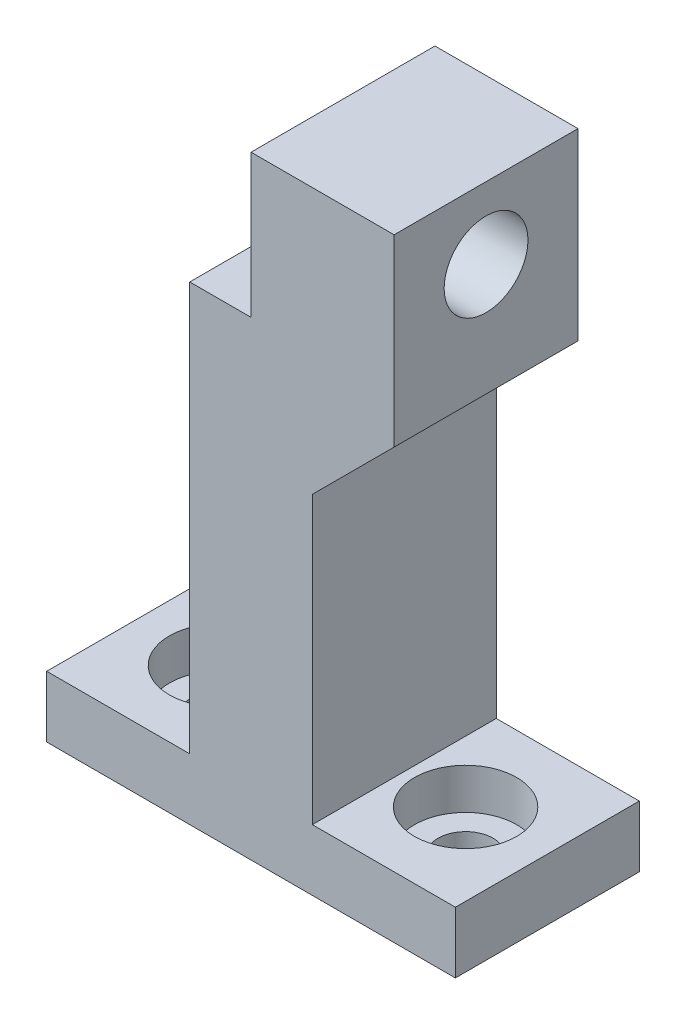
from build123d import *

# Parameters (mm, degrees)
SKETCH1_W           = 20
SKETCH1_H           = 9
BOSS_EXTRUDE1_DEPTH = 3
SKETCH2_R           = 1.35
CUT_EXTRUDE1_DEPTH  = 12.368817001
SKETCH3_R           = 2.5
CUT_EXTRUDE2_DEPTH  = 2
SKETCH4_W           = 6
SKETCH4_H           = 9
BOSS_EXTRUDE2_DEPTH = 20
SKETCH7_W           = 3
SKETCH7_H           = 9
BOSS_EXTRUDE5_DEPTH = 7
SKETCH8_W           = 9
SKETCH8_H           = 9
BOSS_EXTRUDE6_DEPTH = 4
CHAMFER1_SIZE       = 4
SKETCH9_R           = 2.05
CUT_EXTRUDE3_DEPTH  = 32.941352507


with BuildPart() as part:
    # Sketch1 → Boss-Extrude1 (new body)
    with BuildSketch(Plane(origin=(0, 0, 0), x_dir=(1, 0, 0), z_dir=(0, 1, 0))):
        Rectangle(SKETCH1_W, SKETCH1_H)
    extrude(amount=BOSS_EXTRUDE1_DEPTH)

    # Sketch2 → Cut-Extrude1 (cut, through all)
    with BuildSketch(Plane(origin=(0, 3, 0), x_dir=(1, 0, 0), z_dir=(0, 1, 0))):
        with Locations(Location((-6, 0, 0), (0, 0, 270))):
            Circle(SKETCH2_R)
        with Locations(Location((6, 0, 0), (0, 0, 270))):
            Circle(SKETCH2_R)
    extrude(amount=-CUT_EXTRUDE1_DEPTH, mode=Mode.SUBTRACT)

    # Sketch3 → Cut-Extrude2 (cut)
    with BuildSketch(Plane(origin=(0, 3, 0), x_dir=(1, 0, 0), z_dir=(0, 1, 0))):
        with Locations(Location((-6, 0, 0), (0, 0, 270))):
            Circle(SKETCH3_R)
        with Locations(Location((6, 0, 0), (0, 0, 270))):
            Circle(SKETCH3_R)
    extrude(amount=-CUT_EXTRUDE2_DEPTH, mode=Mode.SUBTRACT)

    # Sketch4 → Boss-Extrude2 (add)
    with BuildSketch(Plane(origin=(0, 3, 0), x_dir=(1, 0, 0), z_dir=(0, 1, 0))):
        Rectangle(SKETCH4_W, SKETCH4_H)
    extrude(amount=BOSS_EXTRUDE2_DEPTH)

    # Sketch7 → Boss-Extrude5 (add)
    with BuildSketch(Plane(origin=(0, 23, 0), x_dir=(1, 0, 0), z_dir=(0, 1, 0))):
        with Locations((1.5, 0)):
            Rectangle(SKETCH7_W, SKETCH7_H)
    extrude(amount=BOSS_EXTRUDE5_DEPTH)

    # Sketch8 → Boss-Extrude6 (add)
    with BuildSketch(Plane(origin=(3, 0, 0), x_dir=(0, 0, -1), z_dir=(1, 0, 0))):
        with Locations((0, 25.5)):
            Rectangle(SKETCH8_W, SKETCH8_H)
    extrude(amount=BOSS_EXTRUDE6_DEPTH)

    # Chamfer1
    chamfer1_edges = [part.edges().sort_by_distance(p)[0] for p in [
        (3, 21, 0),
    ]]
    chamfer(chamfer1_edges, length=CHAMFER1_SIZE - 0.0001)  # a hair under: the kernel refuses the full size

    # Sketch9 → Cut-Extrude3 (cut, through all)
    with BuildSketch(Plane.ZY):
        with Locations((0, 26.5)):
            Circle(SKETCH9_R)
    extrude(amount=-CUT_EXTRUDE3_DEPTH, mode=Mode.SUBTRACT)


solid = part.part
